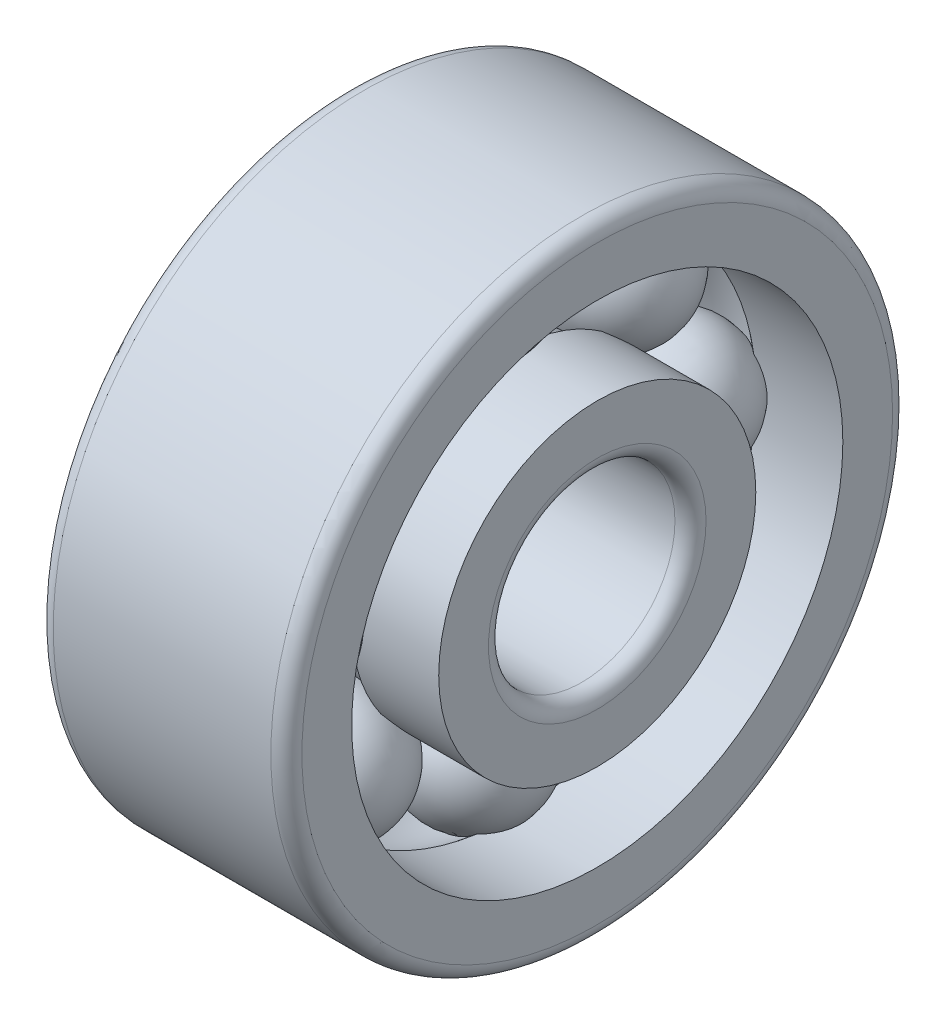
from build123d import *

# Parameters (mm, degrees)
CAGSPISKE_W         = 0.042
CAGSPISKE_H         = 0.07
CAGESPINE_ANGLE     = 0.001
BALLSDETAILED_COUNT = 8
BALLSDETAILED_ANGLE = 315


with BuildPart() as part:
    # CagSpiSke → CageSpine (revolve)
    with BuildSketch(Plane.XY):
        with Locations((0, 0.65)):
            Rectangle(CAGSPISKE_W, CAGSPISKE_H)
    revolve(axis=Axis((-20.6375, 0, 0), (-1, 0, 0)), revolution_arc=CAGESPINE_ANGLE)

    # BalDetSke → BallDetailed (revolve)
    with BuildSketch(Plane.XY):
        with BuildLine():
            Line((-0.21, 0.65), (0.21, 0.65))
            ThreePointArc((0.21, 0.65), (0, 0.44), (-0.21, 0.65))
        make_face()
    balldetailed = revolve(axis=Axis((-1.905, 0.65, 0), (1, 0, 0)))

    # InnRacSke → InnerRace (revolve)
    with BuildSketch(Plane.XY):
        with BuildLine():
            Line((-0.120933866, 0.51), (-0.4, 0.51))
            Line((-0.4, 0.51), (-0.4, 0.35))
            ThreePointArc((-0.4, 0.35), (-0.385355339, 0.314644661), (-0.35, 0.3))
            Line((-0.35, 0.3), (0.35, 0.3))
            ThreePointArc((0.35, 0.3), (0.385355339, 0.314644661), (0.4, 0.35))
            Line((0.4, 0.35), (0.4, 0.51))
            Line((0.4, 0.51), (0.120933866, 0.51))
            ThreePointArc((0.120933866, 0.51), (0, 0.465), (-0.120933866, 0.51))
        make_face()
    revolve(axis=Axis((-20.6375, 0, 0), (1, 0, 0)))

    # OutRacSke → OuterRace (revolve)
    with BuildSketch(Plane.XY):
        with BuildLine():
            Line((-0.120933866, 0.79), (-0.4, 0.79))
            Line((-0.4, 0.79), (-0.4, 0.95))
            ThreePointArc((-0.4, 0.95), (-0.385355339, 0.985355339), (-0.35, 1))
            Line((-0.35, 1), (0.35, 1))
            ThreePointArc((0.35, 1), (0.385355339, 0.985355339), (0.4, 0.95))
            Line((0.4, 0.95), (0.4, 0.79))
            Line((0.4, 0.79), (0.120933866, 0.79))
            ThreePointArc((0.120933866, 0.79), (0, 0.835), (-0.120933866, 0.79))
        make_face()
    revolve(axis=Axis((-20.6375, 0, 0), (1, 0, 0)))

    # BallsDetailed: BallDetailed ×8 about axis
    ballsdetailed_axis = Axis((-50, 0, 0), (1, 0, 0))
    for i in range(1, BALLSDETAILED_COUNT):
        add(balldetailed.rotate(ballsdetailed_axis, i * BALLSDETAILED_ANGLE / (BALLSDETAILED_COUNT - 1)))


solid = part.part
